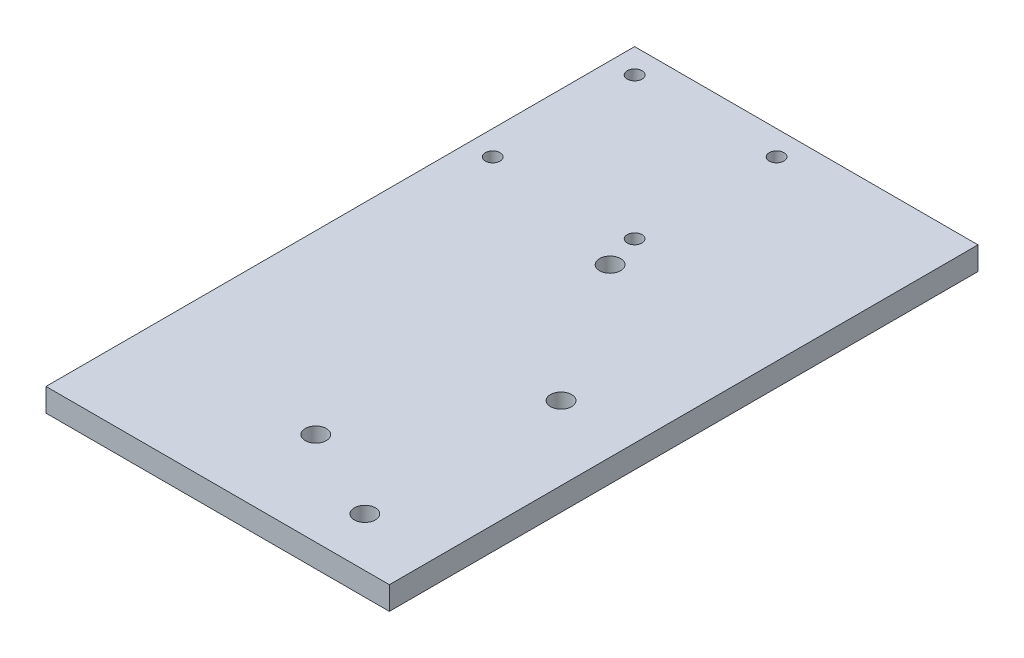
from build123d import *

# Parameters (mm, degrees)
SKETCH2_W               = 88.9
SKETCH2_H               = 152.4
BOSS_EXTRUDE1_DEPTH     = 5.9944
CUT_EXTRUDE2_DEPTH      = 177.535840076
CUT_EXTRUDE2_DEPTH_BACK = 177.535840076
SKETCH4_R               = 2.7305
CUT_EXTRUDE3_DEPTH      = 177.535840076
CUT_EXTRUDE3_DEPTH_BACK = 177.535840076
SKETCH5_R               = 2.7305
CUT_EXTRUDE4_DEPTH      = 177.535840076
CUT_EXTRUDE4_DEPTH_BACK = 177.535840076
SKETCH6_R               = 1.905


with BuildPart() as part:
    # Sketch2 → Boss-Extrude1 (new body)
    with BuildSketch(Plane(origin=(0, 0, 0), x_dir=(1, 0, 0), z_dir=(0, 1, 0))):
        with Locations((44.45, 76.2)):
            Rectangle(SKETCH2_W, SKETCH2_H)
    extrude(amount=BOSS_EXTRUDE1_DEPTH)

    # Sketch4 → Cut-Extrude2 (cut, two sides: drawn at the far end of the back side and taken through both)
    with BuildSketch(Plane(origin=(0, 5.9944, 0), x_dir=(1, 0, 0), z_dir=(0, 1, 0)).offset(-CUT_EXTRUDE2_DEPTH_BACK)):
        with Locations((45.72, 100.33)):
            Circle(SKETCH4_R)
        with Locations((45.72, 24.13)):
            Circle(SKETCH4_R)
    extrude(amount=CUT_EXTRUDE2_DEPTH + CUT_EXTRUDE2_DEPTH_BACK, mode=Mode.SUBTRACT)

    # Sketch5 → Cut-Extrude3 (cut, two sides: drawn at the far end of the back side and taken through both)
    with BuildSketch(Plane(origin=(0, 5.9944, 0), x_dir=(1, 0, 0), z_dir=(0, 1, 0)).offset(-CUT_EXTRUDE3_DEPTH_BACK)):
        with Locations((69.85, 63.5)):
            Circle(SKETCH5_R)
        with Locations((69.85, 12.7)):
            Circle(SKETCH5_R)
    extrude(amount=CUT_EXTRUDE3_DEPTH + CUT_EXTRUDE3_DEPTH_BACK, mode=Mode.SUBTRACT)

    # Sketch6 → Cut-Extrude4 (cut, two sides: drawn at the far end of the back side and taken through both)
    with BuildSketch(Plane(origin=(0, 5.9944, 0), x_dir=(1, 0, 0), z_dir=(0, 1, 0)).offset(-CUT_EXTRUDE4_DEPTH_BACK)):
        with Locations((43.1038, 109.2962)):
            Circle(SKETCH6_R)
        with Locations((6.35, 109.2962)):
            Circle(SKETCH6_R)
        with Locations((6.35, 146.05)):
            Circle(SKETCH6_R)
        with Locations((43.1038, 146.05)):
            Circle(SKETCH6_R)
    extrude(amount=CUT_EXTRUDE4_DEPTH + CUT_EXTRUDE4_DEPTH_BACK, mode=Mode.SUBTRACT)


solid = part.part
